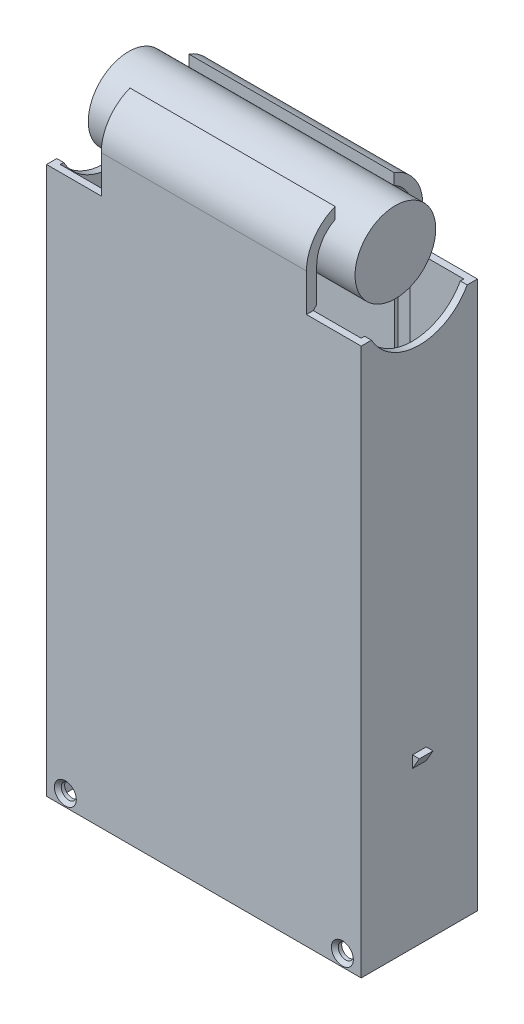
from build123d import *

# Parameters (mm, degrees)
SKETCH_1_W          = 46
SKETCH_1_H          = 17
SKETCH_1_W_2        = 44
SKETCH_1_H_2        = 15
EXTRUDE_1_DEPTH     = 80
SKETCH_4_W          = 11
SKETCH_4_H          = 7.5
CUT_EXTRUDE_1_DEPTH = 30
SKETCH_6_R          = 5.9
EXTRUDE_4_DEPTH     = 19.5
EXTRUDE_3_DEPTH     = 15
CUT_EXTRUDE_2_DEPTH = 60
CUT_EXTRUDE_3_DEPTH = 0.5
CHAMFER_1_SIZE      = 1
EXTRUDE_START       = -7.5
EXTRUDE_7_DEPTH     = 2
CHAMFER_2_SIZE      = 0.5
SKETCH_15_R         = 1.1
CUT_EXTRUDE_5_DEPTH = 40
CHAMFER_3_SIZE      = 0.5


with BuildPart() as part:
    # 草图1 → 凸台-拉伸1 (new body)
    with BuildSketch(Plane(origin=(0, 0, 0), x_dir=(1, 0, 0), z_dir=(0, 1, 0))):
        Rectangle(SKETCH_1_W, SKETCH_1_H)
        Rectangle(SKETCH_1_W_2, SKETCH_1_H_2, mode=Mode.SUBTRACT)
    extrude(amount=EXTRUDE_1_DEPTH)

    # 草图4 → 切除-拉伸1 (cut)
    with BuildSketch(Plane.ZY.offset(23)):
        with Locations((0, 56.25)):
            Rectangle(SKETCH_4_W, SKETCH_4_H)
    extrude(amount=-CUT_EXTRUDE_1_DEPTH, mode=Mode.SUBTRACT)

    # 草图3 → 凸台-拉伸3 (add, symmetric)
    with BuildSketch(Plane(origin=(0, 0, 0), x_dir=(0, 0, -1), z_dir=(1, 0, 0))):
        with BuildLine():
            Line((-8.5, 80), (-8.5, 85.5))
            ThreePointArc((-8.5, 85.5), (-7.34801212, 89.194423684), (-4.300379581, 91.579330044))
            Line((-4.300379581, 91.579330044), (-4.300379581, 89.939397907))
            ThreePointArc((-4.300379581, 89.939397907), (-6.272112938, 88.097893579), (-7, 85.5))
            Line((-7, 85.5), (-7, 80))
            Line((-7, 80), (-8.5, 80))
        make_face()
        with BuildLine():
            Line((4.300379581, 91.579330044), (4.300379581, 89.939397907))
            ThreePointArc((4.300379581, 89.939397907), (6.272112938, 88.097893579), (7, 85.5))
            Line((7, 85.5), (7, 80))
            Line((7, 80), (8.5, 80))
            Line((8.5, 80), (8.5, 85.5))
            ThreePointArc((8.5, 85.5), (7.34801212, 89.194423684), (4.300379581, 91.579330044))
        make_face()
    extrude(amount=EXTRUDE_3_DEPTH, both=True)

    # 草图8 → 切除-拉伸2 (cut)
    with BuildSketch(Plane(origin=(23, 0, 0), x_dir=(0, 0, -1), z_dir=(1, 0, 0))):
        with BuildLine():
            Line((-7, 80), (7, 80))
            ThreePointArc((7, 80), (0, 75.872983346), (-7, 80))
        make_face()
    extrude(amount=-CUT_EXTRUDE_2_DEPTH, mode=Mode.SUBTRACT)

    # 草图11 → 切除-拉伸3 (cut)
    with BuildSketch(Plane.XY.offset(-7.5)):
        Polygon((-14.1, 77), (-14.1, 0), (-11.9, 0), (-11.9, 77), (-13, 77.294744112), align=None)
        Polygon((11.9, 77), (11.9, 0), (14.1, 0), (14.1, 77), (13, 77.294744112), align=None)
    cut_extrude_3 = extrude(amount=-CUT_EXTRUDE_3_DEPTH, mode=Mode.SUBTRACT)

    # 镜向1: 切除-拉伸3 across plane
    add(cut_extrude_3.mirror(Plane.XY), mode=Mode.SUBTRACT)

    # 倒角1
    chamfer_1_edges = [part.edges().sort_by_distance(p)[0] for p in [
        (-23, 56.25, 5.5),
        (-23, 60, 0),
        (-23, 56.25, -5.5),
        (-23, 52.5, 0),
    ]]
    chamfer(chamfer_1_edges, length=CHAMFER_1_SIZE - 0.0001)  # a hair under: the kernel refuses the full size

    # 草图13 → 凸台-拉伸7 (add)
    with BuildSketch(Plane.XY.offset(8.5).offset(EXTRUDE_START)):
        Polygon((-23, 22.767949192), (-24, 24.5), (-23, 24.5), align=None)
        Polygon((23, 24.5), (23, 22.767949192), (24, 24.5), align=None)
    extrude(amount=-EXTRUDE_7_DEPTH)

    # 倒角2
    chamfer_2_edges = [part.edges().sort_by_distance(p)[0] for p in [
        (0, 80, 7),
        (0, 80, -7),
    ]]
    chamfer(chamfer_2_edges, length=CHAMFER_2_SIZE - 0.0001)  # a hair under: the kernel refuses the full size

    # 草图15 → 切除-拉伸5 (cut)
    with BuildSketch(Plane.XY.offset(8.5)):
        with Locations((-20.25, 1.75)):
            Circle(SKETCH_15_R)
        with Locations((20.25, 1.75)):
            Circle(SKETCH_15_R)
    extrude(amount=-CUT_EXTRUDE_5_DEPTH, mode=Mode.SUBTRACT)

    # 倒角3
    chamfer_3_edges = [part.edges().sort_by_distance(p)[0] for p in [
        (19.15, 1.75, -8.5),
        (19.15, 1.75, 8.5),
        (-21.35, 1.75, -8.5),
        (-21.35, 1.75, 8.5),
    ]]
    chamfer(chamfer_3_edges, length=CHAMFER_3_SIZE)


with BuildPart() as body_2:
    # 草图6 → 凸台-拉伸4 (new, symmetric)
    with BuildSketch(Plane(origin=(0, 0, 0), x_dir=(0, 0, -1), z_dir=(1, 0, 0))):
        with Locations((0, 85.9)):
            Circle(SKETCH_6_R)
    extrude(amount=EXTRUDE_4_DEPTH, both=True)


solid = Compound([part.part, body_2.part])
